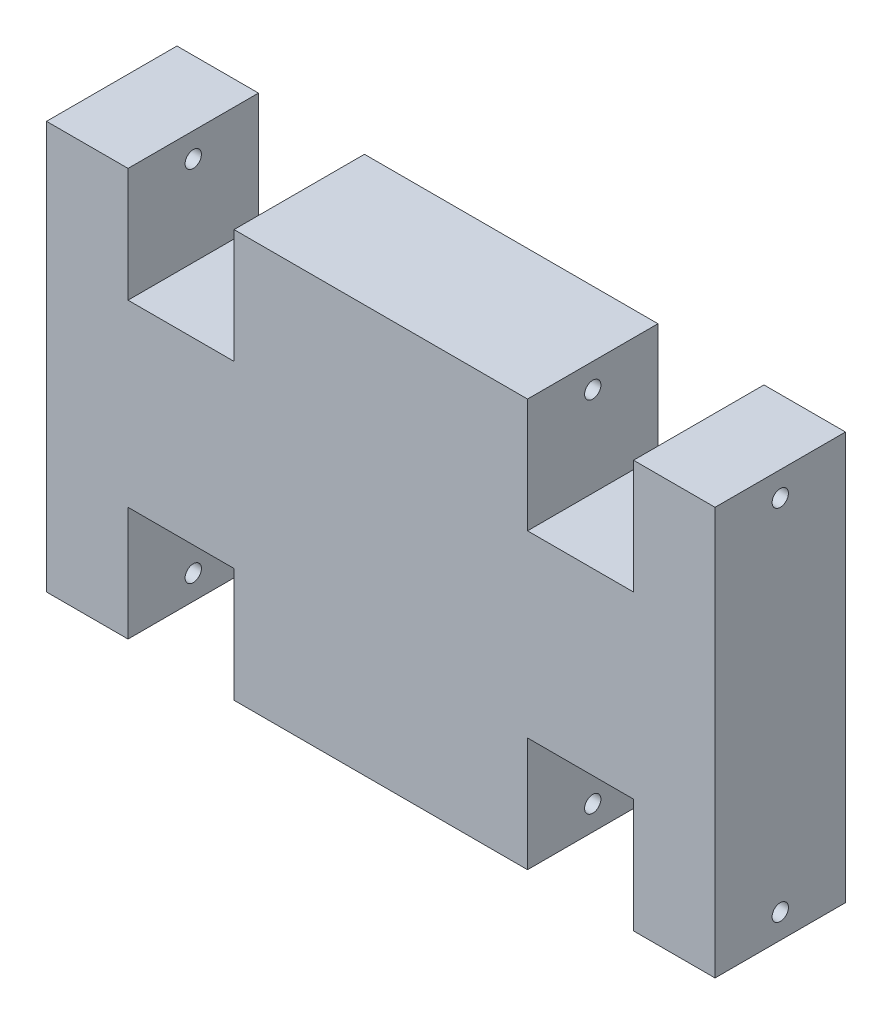
from build123d import *

# Parameters (mm, degrees)
SALIENTE_EXTRUIR2_DEPTH = 8
CROQUIS3_R              = 0.5
CORTAR_EXTRUIR1_DEPTH   = 45


with BuildPart() as part:
    # Croquis1 → Saliente-Extruir2 (new body)
    with BuildSketch(Plane.XY):
        Polygon((0, 0), (5, 0), (5, 7), (11.5, 7), (11.5, 0), (29.5, 0), (29.5, 7), (36, 7), (36, 0), (41, 0), (41, 25), (36, 25), (36, 18), (29.5, 18), (29.5, 25), (11.5, 25), (11.5, 18), (5, 18), (5, 25), (0, 25), align=None)
    extrude(amount=SALIENTE_EXTRUIR2_DEPTH)

    # Croquis3 → Cortar-Extruir1 (cut)
    with BuildSketch(Plane(origin=(41, 0, 0), x_dir=(0, 0, -1), z_dir=(1, 0, 0))):
        with Locations((-4, 23.498247599)):
            Circle(CROQUIS3_R)
        with Locations((-4, 1.501752401)):
            Circle(CROQUIS3_R)
    extrude(amount=-CORTAR_EXTRUIR1_DEPTH, mode=Mode.SUBTRACT)


solid = part.part
